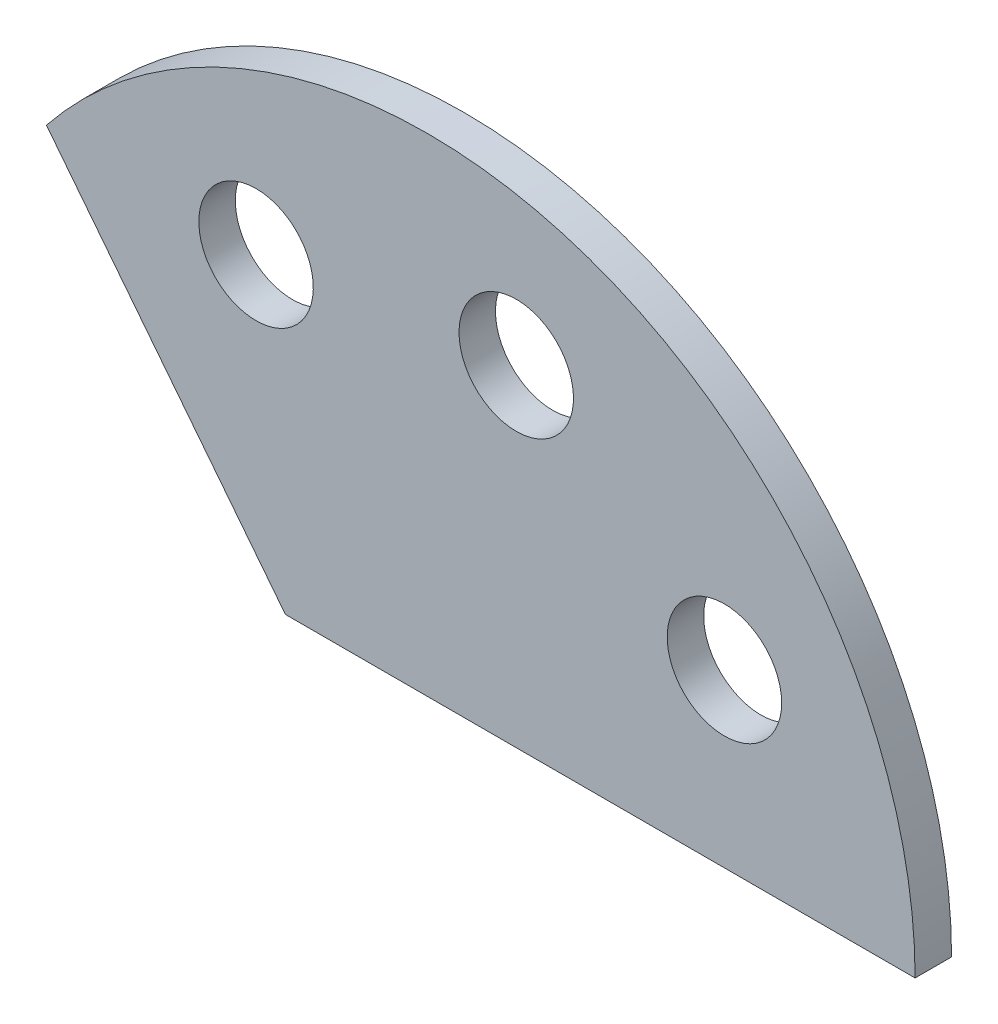
from build123d import *

# Parameters (mm, degrees)
SKETCH1_R             = 7.178016374
EXTRUDE1_DEPTH        = 4.572
CIRPATTERN3_START     = -4.572
CIRPATTERN3_OUTLINE_R = 7.178016374
CIRPATTERN3_DEPTH     = 4.572


# Read off the part's stored shape, not the designer's step: CirPattern3
with BuildPart() as part:
    # Sketch1 → Extrude1 (new body)
    with BuildSketch(Plane.XY):
        with BuildLine():
            Line((-17.82605161, 0), (61.168535359, 0))
            ThreePointArc((61.168535359, 0), (20.218554782, 57.730405857), (-47.802514574, 38.164241357))
            Line((-47.802514574, 38.164241357), (-17.82605161, 0))
        make_face()
        with Locations((37.24834288, 21.505340789)):
            Circle(SKETCH1_R, mode=Mode.SUBTRACT)
    extrude(amount=-EXTRUDE1_DEPTH)

    # CirPattern3 outline → CirPattern3 (cut)
    with BuildSketch(Plane.XY.offset(CIRPATTERN3_START)):
        with Locations((-21.505340789, 37.24834288)):
            Circle(CIRPATTERN3_OUTLINE_R)
        with Locations((11.131983535, 41.545128142)):
            Circle(CIRPATTERN3_OUTLINE_R)
    extrude(amount=CIRPATTERN3_DEPTH, mode=Mode.SUBTRACT)


solid = part.part
